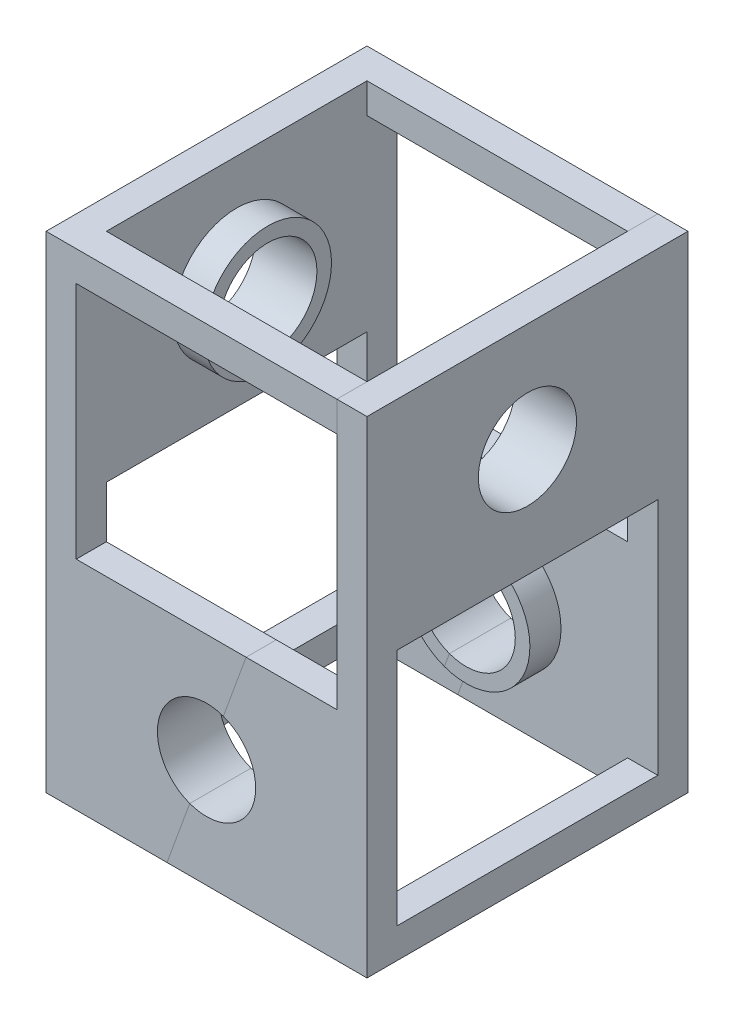
from build123d import *

# Parameters (mm, degrees)
SKETCH2_W                = 83.82
SKETCH2_H                = 83.82
BOSS_EXTRUDE1_DEPTH      = 127
SKETCH3_R                = 12.827
CUT_EXTRUDE1_DEPTH       = 158.832951249
SKETCH4_R                = 12.827
CUT_EXTRUDE2_DEPTH       = 158.832951249
SKETCH5_W                = 68.072
SKETCH5_H                = 68.072
CUT_EXTRUDE3_DEPTH       = 141.149549411
SKETCH6_W                = 68.072
SKETCH6_H                = 62.357
CUT_EXTRUDE4_DEPTH       = 158.832951249
SKETCH7_W                = 68.072
SKETCH7_H                = 62.357
CUT_EXTRUDE5_DEPTH       = 158.832951249
BOSS_EXTRUDE6_START      = 8.128
SKETCH18_R               = 16.637
SKETCH18_R_2             = 12.827
BOSS_EXTRUDE6_DEPTH      = 8.128
SKETCH19_R               = 16.637
SKETCH19_R_2             = 12.827
BOSS_EXTRUDE7_DEPTH      = 8.128
SKETCH20_R               = 16.637
SKETCH20_R_2             = 12.827
BOSS_EXTRUDE8_DEPTH      = 8.128
BOSS_EXTRUDE9_START      = 8.128
SKETCH21_R               = 16.637
SKETCH21_R_2             = 12.827
BOSS_EXTRUDE9_DEPTH      = 8.128
INTERSECT1_START         = -41.91
INTERSECT1_DEPTH         = 83.82
INTERSECT1_START_2       = -25.908
INTERSECT1_2_OUTLINE_W   = 8.128
INTERSECT1_2_OUTLINE_H   = 56.769
INTERSECT1_2_DEPTH       = 51.816
INTERSECT1_3_OUTLINE_W   = 7.874
INTERSECT1_3_OUTLINE_H   = 56.769
INTERSECT1_3_OUTLINE_H_2 = 7.874
INTERSECT1_3_DEPTH       = 83.82
INTERSECT1_4_DEPTH       = 7.874
INTERSECT1_START_3       = 34.036
INTERSECT1_5_DEPTH       = 7.874
INTERSECT1_START_4       = -34.036
INTERSECT1_6_DEPTH       = 8.128
INTERSECT1_START_5       = 25.908
INTERSECT1_7_DEPTH       = 8.128
INTERSECT1_8_OUTLINE_R   = 12.827
INTERSECT1_8_DEPTH       = 7.874
INTERSECT1_9_OUTLINE_R   = 16.637
INTERSECT1_9_OUTLINE_R_2 = 12.827
INTERSECT1_9_DEPTH       = 8.128


with BuildPart() as part:
    # Sketch2 → Boss-Extrude1 (new body)
    with BuildSketch(Plane(origin=(0, 0, 0), x_dir=(1, 0, 0), z_dir=(0, 1, 0))):
        Rectangle(SKETCH2_W, SKETCH2_H)
    extrude(amount=BOSS_EXTRUDE1_DEPTH)

    # Sketch3 → Cut-Extrude1 (cut, through all)
    with BuildSketch(Plane.XY.offset(41.91)):
        with Locations((0, 28.3845)):
            Circle(SKETCH3_R)
    extrude(amount=-CUT_EXTRUDE1_DEPTH, mode=Mode.SUBTRACT)

    # Sketch4 → Cut-Extrude2 (cut, through all)
    with BuildSketch(Plane(origin=(41.91, 0, 0), x_dir=(0, 0, -1), z_dir=(1, 0, 0))):
        with Locations((0, 98.6155)):
            Circle(SKETCH4_R)
    extrude(amount=-CUT_EXTRUDE2_DEPTH, mode=Mode.SUBTRACT)

    # Sketch5 → Cut-Extrude3 (cut, through all)
    with BuildSketch(Plane(origin=(0, 127, 0), x_dir=(1, 0, 0), z_dir=(0, 1, 0))):
        Rectangle(SKETCH5_W, SKETCH5_H)
    extrude(amount=-CUT_EXTRUDE3_DEPTH, mode=Mode.SUBTRACT)

    # Sketch6 → Cut-Extrude4 (cut, through all)
    with BuildSketch(Plane(origin=(41.91, 0, 0), x_dir=(0, 0, -1), z_dir=(1, 0, 0))):
        with Locations((0, 39.0525)):
            Rectangle(SKETCH6_W, SKETCH6_H)
    extrude(amount=-CUT_EXTRUDE4_DEPTH, mode=Mode.SUBTRACT)

    # Sketch7 → Cut-Extrude5 (cut, through all)
    with BuildSketch(Plane.XY.offset(41.91)):
        with Locations((0, 87.9475)):
            Rectangle(SKETCH7_W, SKETCH7_H)
    extrude(amount=-CUT_EXTRUDE5_DEPTH, mode=Mode.SUBTRACT)

    # Sketch18 → Boss-Extrude6 (add)
    with BuildSketch(Plane(origin=(-34.036, 0, 0), x_dir=(0, 0, -1), z_dir=(1, 0, 0)).offset(BOSS_EXTRUDE6_START)):
        with Locations(Location((0, 98.6155, 0), (0, 0, 180))):
            Circle(SKETCH18_R)
        with Locations((0, 98.6155)):
            Circle(SKETCH18_R_2, mode=Mode.SUBTRACT)
    extrude(amount=-BOSS_EXTRUDE6_DEPTH)

    # Sketch19 → Boss-Extrude7 (add)
    with BuildSketch(Plane.ZY.offset(-34.036)):
        with Locations((0, 98.6155)):
            Circle(SKETCH19_R)
        with Locations(Location((0, 98.6155, 0), (0, 0, 180))):
            Circle(SKETCH19_R_2, mode=Mode.SUBTRACT)
    extrude(amount=BOSS_EXTRUDE7_DEPTH)

    # Sketch20 → Boss-Extrude8 (add)
    with BuildSketch(Plane(origin=(0, 0, 34.036), x_dir=(-1, 0, 0), z_dir=(0, 0, -1))):
        with Locations(Location((0, 28.3845, 0), (0, 0, 180))):
            Circle(SKETCH20_R)
        with Locations(Location((0, 28.3845, 0), (0, 0, 180))):
            Circle(SKETCH20_R_2, mode=Mode.SUBTRACT)
    extrude(amount=BOSS_EXTRUDE8_DEPTH)

    # Sketch21 → Boss-Extrude9 (add)
    with BuildSketch(Plane.XY.offset(-34.036).offset(BOSS_EXTRUDE9_START)):
        with Locations((0, 28.3845)):
            Circle(SKETCH21_R)
        with Locations((0, 28.3845)):
            Circle(SKETCH21_R_2, mode=Mode.SUBTRACT)
    extrude(amount=-BOSS_EXTRUDE9_DEPTH)

    # Intersect1: read off the stored shape, not the designer's step
    # Intersect1 outline → Intersect1 (cut)
    with BuildSketch(Plane.XY.offset(INTERSECT1_START)):
        with BuildLine():
            Line((41.91, 127), (34.036, 127))
            Line((34.036, 127), (34.036, 56.769))
            Line((34.036, 56.769), (10.331113115, 56.769))
            Line((10.331113115, 56.769), (4.387092378, 40.437937247))
            ThreePointArc((4.387092378, 40.437937247), (12.053437247, 23.997407622), (-4.387092378, 16.331062753))
            Line((-4.387092378, 16.331062753), (-10.331113115, 0))
            Line((-10.331113115, 0), (41.91, 0))
            Line((41.91, 0), (41.91, 127))
        make_face()
    extrude(amount=INTERSECT1_DEPTH, mode=Mode.SUBTRACT)

    # Intersect1 2 outline → Intersect1 2 (cut)
    with BuildSketch(Plane.XY.offset(INTERSECT1_START_2)):
        with Locations((29.972, 98.6155)):
            Rectangle(INTERSECT1_2_OUTLINE_W, INTERSECT1_2_OUTLINE_H)
    extrude(amount=INTERSECT1_2_DEPTH, mode=Mode.SUBTRACT)


with BuildPart() as body_2:
    # Intersect1 3 outline → Intersect1 3 (new body)
    with BuildSketch(Plane.XY.offset(INTERSECT1_START)):
        with Locations((37.973, 98.6155)):
            Rectangle(INTERSECT1_3_OUTLINE_W, INTERSECT1_3_OUTLINE_H)
        with Locations((37.973, 3.937)):
            Rectangle(INTERSECT1_3_OUTLINE_W, INTERSECT1_3_OUTLINE_H_2)
    extrude(amount=INTERSECT1_3_DEPTH)

    # Intersect1 4 outline → Intersect1 4 (add)
    with BuildSketch(Plane.XY.offset(INTERSECT1_START)):
        with BuildLine():
            ThreePointArc((4.387092378, 40.437937247), (12.053437247, 23.997407622), (-4.387092378, 16.331062753))
            Line((-4.387092378, 16.331062753), (-10.331113115, 0))
            Line((-10.331113115, 0), (34.036, 0))
            Line((34.036, 0), (34.036, 7.874))
            Line((34.036, 7.874), (41.91, 7.874))
            Line((41.91, 7.874), (41.91, 70.231))
            Line((41.91, 70.231), (34.036, 70.231))
            Line((34.036, 70.231), (34.036, 56.769))
            Line((34.036, 56.769), (10.331113115, 56.769))
            Line((10.331113115, 56.769), (4.387092378, 40.437937247))
        make_face()
    extrude(amount=INTERSECT1_4_DEPTH)

    # Intersect1 5 outline → Intersect1 5 (add)
    with BuildSketch(Plane.XY.offset(INTERSECT1_START_3)):
        with BuildLine():
            ThreePointArc((4.387092378, 40.437937247), (12.053437247, 23.997407622), (-4.387092378, 16.331062753))
            Line((-4.387092378, 16.331062753), (-10.331113115, 0))
            Line((-10.331113115, 0), (34.036, 0))
            Line((34.036, 0), (34.036, 7.874))
            Line((34.036, 7.874), (41.91, 7.874))
            Line((41.91, 7.874), (41.91, 70.231))
            Line((41.91, 70.231), (34.036, 70.231))
            Line((34.036, 70.231), (34.036, 56.769))
            Line((34.036, 56.769), (10.331113115, 56.769))
            Line((10.331113115, 56.769), (4.387092378, 40.437937247))
        make_face()
    extrude(amount=INTERSECT1_5_DEPTH)

    # Intersect1 6 outline → Intersect1 6 (add)
    with BuildSketch(Plane.XY.offset(INTERSECT1_START_4)):
        with BuildLine():
            Line((5.690189125, 44.018166132), (4.387092378, 40.437937247))
            ThreePointArc((4.387092378, 40.437937247), (12.053437247, 23.997407622), (-4.387092378, 16.331062753))
            Line((-4.387092378, 16.331062753), (-5.690189125, 12.750833868))
            ThreePointArc((-5.690189125, 12.750833868), (15.633666132, 22.694310875), (5.690189125, 44.018166132))
        make_face()
    extrude(amount=INTERSECT1_6_DEPTH)

    # Intersect1 7 outline → Intersect1 7 (add)
    with BuildSketch(Plane.XY.offset(INTERSECT1_START_5)):
        with BuildLine():
            Line((5.690189125, 44.018166132), (4.387092378, 40.437937247))
            ThreePointArc((4.387092378, 40.437937247), (12.053437247, 23.997407622), (-4.387092378, 16.331062753))
            Line((-4.387092378, 16.331062753), (-5.690189125, 12.750833868))
            ThreePointArc((-5.690189125, 12.750833868), (15.633666132, 22.694310875), (5.690189125, 44.018166132))
        make_face()
    extrude(amount=INTERSECT1_7_DEPTH)

    # Intersect1 8 outline → Intersect1 8 (cut)
    with BuildSketch(Plane.YZ.offset(INTERSECT1_START_3)):
        with Locations((98.6155, 0)):
            Circle(INTERSECT1_8_OUTLINE_R)
    extrude(amount=INTERSECT1_8_DEPTH, mode=Mode.SUBTRACT)

    # Intersect1 9 outline → Intersect1 9 (add)
    with BuildSketch(Plane.YZ.offset(INTERSECT1_START_5)):
        with Locations((98.6155, 0)):
            Circle(INTERSECT1_9_OUTLINE_R)
        with Locations((98.6155, 0)):
            Circle(INTERSECT1_9_OUTLINE_R_2, mode=Mode.SUBTRACT)
    extrude(amount=INTERSECT1_9_DEPTH)


solid = Compound([part.part, body_2.part])
